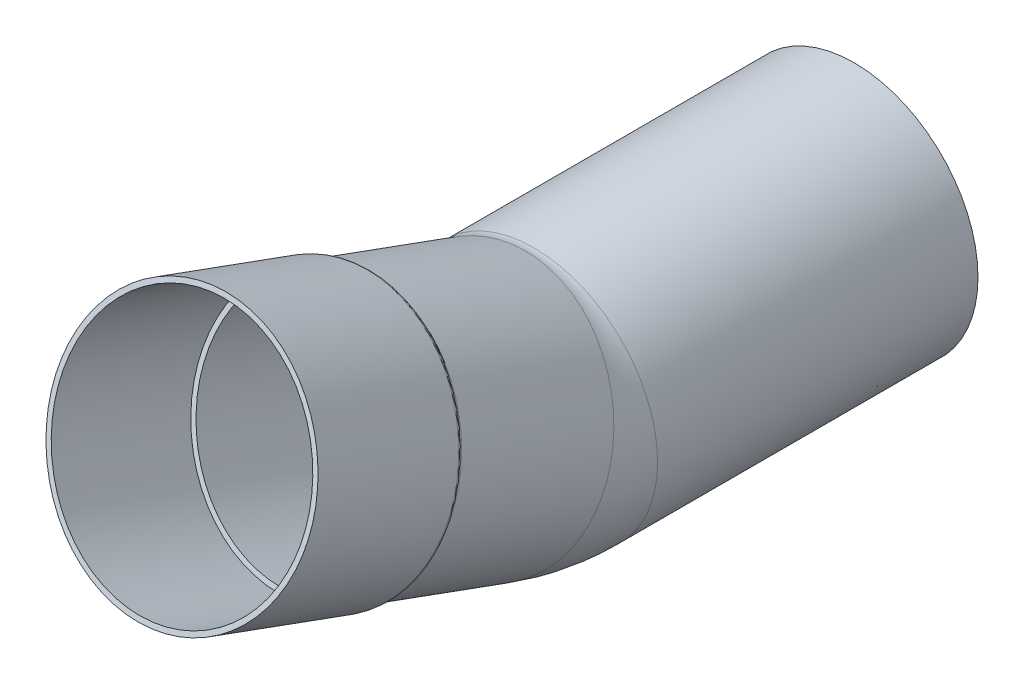
from build123d import *

# Parameters (mm, degrees)
ESQUISSE6_R        = 25
ESQUISSE6_R_2      = 24
ESQUISSE8_R        = 26.000000000000004
ESQUISSE8_R_2      = 24.000000000000004
EXTRU_MINCE1_DEPTH = 1
EXTRU_MINCE2_START = 30
ESQUISSE9_R        = 26
ESQUISSE9_R_2      = 25
EXTRU_MINCE2_DEPTH = 30
CONG_1_R           = 1
CONG_2_R           = 1


with BuildPart() as part:
    # Balayage-Mince2: sweep along a path in Esquisse7
    with BuildLine(Plane(origin=(0, 0, 0), x_dir=(0, 0, -1), z_dir=(1, 0, 0))) as balayage_mince2_path:
        Line((0, 0), (-64.71019057874605, -6.94e-15))
        ThreePointArc((-64.71019057874605, -6.94e-15), (-69.91963590875396, 0.45576740963375073), (-74.97079487851613, 1.8092213764227365))
        Line((-74.97079487851613, 1.8092213764227365), (-106.64801221065042, 13.338785589701102))
    # Esquisse6 → Balayage-Mince2 (sweep)
    with BuildSketch(Plane.XY):
        Circle(ESQUISSE6_R)
        Circle(ESQUISSE6_R_2, mode=Mode.SUBTRACT)
    sweep(path=balayage_mince2_path.line)



with BuildPart() as body_2:
    # Esquisse8 → Extru.-Mince1 (new body)
    with BuildSketch(Plane(origin=(0, 35.836351928730004, 98.45956771981464), x_dir=(1, 0, 0), z_dir=(0, 0.34202014332566966, 0.9396926207859081))):
        with Locations((0, -23.94141003279684)):
            Circle(ESQUISSE8_R)
        with Locations((0, -23.94141003279684)):
            Circle(ESQUISSE8_R_2, mode=Mode.SUBTRACT)
    extrude(amount=EXTRU_MINCE1_DEPTH)


with BuildPart() as part_1:
    add(part.part)

    add(body_2.part)  # Extru.-Mince2 merges body 2
    # Esquisse9 → Extru.-Mince2 (add)
    with BuildSketch(Plane(origin=(0, 36.17837207205572, 99.39926034060053), x_dir=(1, 0, 0), z_dir=(0, 0.3420201433256696, 0.9396926207859081)).offset(EXTRU_MINCE2_START)):
        with Locations((0, -23.941410032796895)):
            Circle(ESQUISSE9_R)
        with Locations((0, -23.941410032796895)):
            Circle(ESQUISSE9_R_2, mode=Mode.SUBTRACT)
    extrude(amount=-EXTRU_MINCE2_DEPTH)

    # Congé1
    cong_1_edges = [part_1.edges().sort_by_distance(p)[0] for p in [
        (-25, 13.338785589701132, 106.6480122106504),
    ]]
    fillet(cong_1_edges, radius=CONG_1_R - 0.0001)  # a hair under: the kernel refuses the full size

    # Congé2
    cong_2_edges = [part_1.edges().sort_by_distance(p)[0] for p in [
        (-26.000000000000004, 13.33878558970111, 106.64801221065045),
    ]]
    fillet(cong_2_edges, radius=CONG_2_R)


solid = part_1.part
